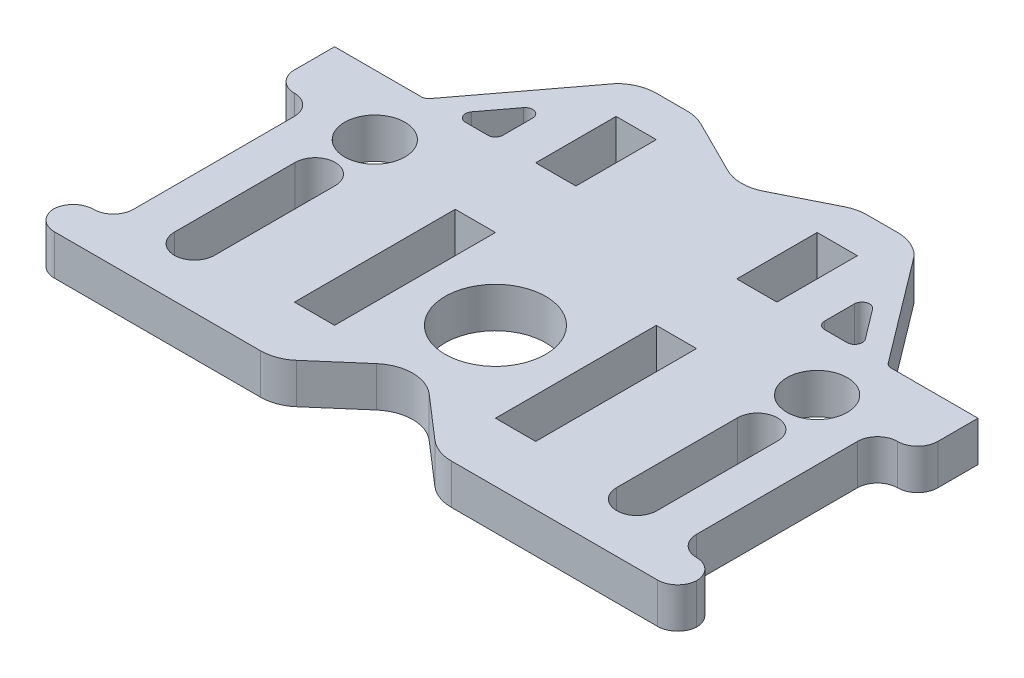
from build123d import *

# Parameters (mm, degrees)
SKETCH1_R           = 3.175
SKETCH1_W           = 3.175
SKETCH1_H           = 12.7
SKETCH1_H_2         = 6.35
BOSS_EXTRUDE1_DEPTH = 3.175
FILLET1_R           = 1.5875
SKETCH2_R           = 2.38125
CUT_EXTRUDE1_DEPTH  = 46.900442536
FILLET2_R           = 3.175
FILLET4_R           = 0.6
SKETCH3_W           = 59.294957885
SKETCH3_H           = 30.48
CUT_EXTRUDE5_DEPTH  = 46.900442536
FILLET5_R           = 1.5875
CUT_EXTRUDE6_DEPTH  = 34.89972345
SKETCH5_R           = 3.96875
CUT_EXTRUDE7_DEPTH  = 34.89972345
FILLET6_R           = 3.175


with BuildPart() as part:
    # Sketch1 → Boss-Extrude1 (new body)
    with BuildSketch(Plane(origin=(0, 0, 0), x_dir=(1, 0, 0), z_dir=(0, 1, 0))):
        with BuildLine():
            Line((25.4, -12.7), (25.4, -9.525))
            ThreePointArc((25.4, -9.525), (24.935032015, -8.402467985), (23.8125, -7.9375))
            ThreePointArc((23.8125, -7.9375), (22.689967985, -7.472532015), (22.225, -6.35))
            Line((22.225, -6.35), (22.225, 6.35))
            ThreePointArc((22.225, 6.35), (22.689967985, 7.472532015), (23.8125, 7.9375))
            ThreePointArc((23.8125, 7.9375), (24.935032015, 8.402467985), (25.4, 9.525))
            Line((25.4, 9.525), (25.4, 12.7))
            Line((25.4, 12.7), (23.8125, 12.7))
            Line((23.8125, 12.7), (18.25625, 12.7))
            Line((18.25625, 12.7), (11.77006403, 21.29506403))
            ThreePointArc((11.77006403, 21.29506403), (10.740019898, 21.983317516), (9.525, 22.225))
            Line((9.525, 22.225), (6.35, 22.225))
            Line((6.35, 22.225), (0, 19.05))
            Line((0, 19.05), (-6.35, 22.225))
            Line((-6.35, 22.225), (-9.525, 22.225))
            ThreePointArc((-9.525, 22.225), (-10.740019898, 21.983317516), (-11.77006403, 21.29506403))
            Line((-11.77006403, 21.29506403), (-18.25625, 12.7))
            Line((-18.25625, 12.7), (-23.8125, 12.7))
            Line((-23.8125, 12.7), (-25.4, 12.7))
            Line((-25.4, 12.7), (-25.4, 9.525))
            ThreePointArc((-25.4, 9.525), (-24.935032015, 8.402467985), (-23.8125, 7.9375))
            ThreePointArc((-23.8125, 7.9375), (-22.689967985, 7.472532015), (-22.225, 6.35))
            Line((-22.225, 6.35), (-22.225, -6.35))
            ThreePointArc((-22.225, -6.35), (-22.689967985, -7.472532015), (-23.8125, -7.9375))
            ThreePointArc((-23.8125, -7.9375), (-24.935032015, -8.402467985), (-25.4, -9.525))
            Line((-25.4, -9.525), (-25.4, -12.7))
            Line((-25.4, -12.7), (-25.4, -31.75))
            ThreePointArc((-25.4, -31.75), (-20.422679281, -37.949858998), (-13.293464066, -34.430446612))
            Line((-13.293464066, -34.430446612), (-3.175, -12.7))
            Line((-3.175, -12.7), (3.175, -12.7))
            Line((3.175, -12.7), (13.293464066, -34.430446612))
            ThreePointArc((13.293464066, -34.430446612), (20.422679281, -37.949858998), (25.4, -31.75))
            Line((25.4, -31.75), (25.4, -12.7))
        make_face()
        with Locations(Location((-19.05, -31.75, 0), (0, 0, 270))):
            Circle(SKETCH1_R, mode=Mode.SUBTRACT)
        with Locations(Location((19.05, -31.75, 0), (0, 0, 270))):
            Circle(SKETCH1_R, mode=Mode.SUBTRACT)
        with Locations((-7.9375, 0)):
            Rectangle(SKETCH1_W, SKETCH1_H, mode=Mode.SUBTRACT)
        with BuildLine():
            Line((-19.05, -12.7), (-19.05, -22.225))
            ThreePointArc((-19.05, -22.225), (-16.990981078, -22.450211503), (-15.029330082, -23.115196099))
            Line((-15.029330082, -23.115196099), (-10.179646624, -12.7))
            Line((-10.179646624, -12.7), (-19.05, -12.7))
        make_face(mode=Mode.SUBTRACT)
        with BuildLine():
            Line((10.179646624, -12.7), (19.05, -12.7))
            Line((19.05, -12.7), (19.05, -22.225))
            ThreePointArc((19.05, -22.225), (16.990981078, -22.450211503), (15.029330082, -23.115196099))
            Line((15.029330082, -23.115196099), (10.179646624, -12.7))
        make_face(mode=Mode.SUBTRACT)
        with Locations((7.9375, 0)):
            Rectangle(SKETCH1_W, SKETCH1_H, mode=Mode.SUBTRACT)
        with Locations((-7.9375, 15.875)):
            Rectangle(SKETCH1_W, SKETCH1_H_2, mode=Mode.SUBTRACT)
        Polygon((16.267445908, 12.7), (12.7, 12.7), (12.7, 17.427343025), align=None, mode=Mode.SUBTRACT)
        with Locations((7.9375, 15.875)):
            Rectangle(SKETCH1_W, SKETCH1_H_2, mode=Mode.SUBTRACT)
        Polygon((-12.7, 12.7), (-12.7, 17.427343025), (-16.267445908, 12.7), align=None, mode=Mode.SUBTRACT)
    extrude(amount=BOSS_EXTRUDE1_DEPTH)

    # Fillet1
    fillet1_edges = [part.edges().sort_by_distance(p)[0] for p in [
        (3.175, 1.5875, 12.7),
        (-3.175, 1.5875, 12.7),
        (-10.179646624, 1.5875, 12.7),
        (-19.05, 1.5875, 12.7),
        (19.05, 1.5875, 12.7),
        (10.179646624, 1.5875, 12.7),
    ]]
    fillet(fillet1_edges, radius=FILLET1_R)

    # Sketch2 → Cut-Extrude1 (cut, through all)
    with BuildSketch(Plane(origin=(0, 3.175, 0), x_dir=(1, 0, 0), z_dir=(0, 1, 0))):
        with Locations(Location((-17.4625, 7.9375, 0), (0, 0, 270))):
            Circle(SKETCH2_R)
        with Locations(Location((17.4625, 7.9375, 0), (0, 0, 90))):
            Circle(SKETCH2_R)
    extrude(amount=-CUT_EXTRUDE1_DEPTH, mode=Mode.SUBTRACT)

    # Fillet2
    fillet2_edges = [part.edges().sort_by_distance(p)[0] for p in [
        (-6.35, 1.5875, -22.225),
        (0, 1.5875, -19.05),
        (6.35, 1.5875, -22.225),
    ]]
    fillet(fillet2_edges, radius=FILLET2_R)

    # Fillet4
    fillet4_edges = [part.edges().sort_by_distance(p)[0] for p in [
        (18.25625, 1.5875, -12.7),
        (-18.25625, 1.5875, -12.7),
        (16.267445908, 1.5875, -12.7),
        (12.7, 1.5875, -17.427343025),
        (12.7, 1.5875, -12.7),
        (-12.7, 1.5875, -12.7),
        (-12.7, 1.5875, -17.427343025),
        (-16.267445908, 1.5875, -12.7),
    ]]
    fillet(fillet4_edges, radius=FILLET4_R)

    # Sketch3 → Cut-Extrude5 (cut, through all)
    with BuildSketch(Plane(origin=(0, 3.175, 0), x_dir=(1, 0, 0), z_dir=(0, 1, 0))):
        with Locations((-1.965596619, -26.253733592)):
            Rectangle(SKETCH3_W, SKETCH3_H)
    extrude(amount=-CUT_EXTRUDE5_DEPTH, mode=Mode.SUBTRACT)

    # Fillet5
    # the kernel refuses this fillet: 1.5875 mm, written as the material it takes off along each edge
    with BuildSketch(Plane(origin=(25.4, -3.961061605, 11.013733592), x_dir=(0, 0, -1), z_dir=(0, 1, 0))) as fillet5_piece_1:
        with BuildLine():
            CenterArc((1.5875, 1.584424642), FILLET5_R, 180, 86.433035976)
            Line((0, 1.584424642), (-0.03175, 1.584424642))
            Line((-0.03175, 1.584424642), (-0.03175, 0))
            Line((-0.03175, 0), (0, -0.03175))
            ThreePointArc((0, -0.03175), (0.744366796, -0.03175), (1.486758264, -0.031688493))
            Line((1.486758264, -0.031688493), (1.488733592, 0))
        make_face()
    extrude(amount=11.097123211, mode=Mode.SUBTRACT)
    with BuildSketch(Plane(origin=(-25.4, 7.136061605, 11.013733592), x_dir=(1, 0, 0), z_dir=(0, -1, 0))) as fillet5_piece_2:
        with BuildLine():
            CenterArc((1.584424642, -1.5875), FILLET5_R, 90, 86.433035976)
            Line((0, -1.488733592), (-0.031688493, -1.486758264))
            ThreePointArc((-0.031688493, -1.486758264), (-0.03175, -0.744366796), (-0.03175, 0))
            Line((-0.03175, 0), (0, 0.03175))
            Line((0, 0.03175), (1.584424642, 0.03175))
            Line((1.584424642, 0.03175), (1.584424642, 0))
        make_face()
    extrude(amount=11.097123211, mode=Mode.SUBTRACT)

    # Sketch4 → Cut-Extrude6 (cut, through all)
    with BuildSketch(Plane(origin=(0, 3.175, 0), x_dir=(1, 0, 0), z_dir=(0, 1, 0))):
        with BuildLine():
            Line((-15.875, 3.224383204), (-15.875, -6.300616796))
            ThreePointArc((-15.875, -6.300616796), (-17.4625, -7.888116796), (-19.05, -6.300616796))
            Line((-19.05, -6.300616796), (-19.05, 3.224383204))
            ThreePointArc((-19.05, 3.224383204), (-17.4625, 4.811883204), (-15.875, 3.224383204))
        make_face()
        with BuildLine():
            Line((15.875, 3.224383204), (15.875, -6.300616796))
            ThreePointArc((15.875, -6.300616796), (17.4625, -7.888116796), (19.05, -6.300616796))
            Line((19.05, -6.300616796), (19.05, 3.224383204))
            ThreePointArc((19.05, 3.224383204), (17.4625, 4.811883204), (15.875, 3.224383204))
        make_face()
    extrude(amount=-CUT_EXTRUDE6_DEPTH, mode=Mode.SUBTRACT)

    # Sketch5 → Cut-Extrude7 (cut, through all)
    with BuildSketch(Plane(origin=(0, 3.175, 0), x_dir=(1, 0, 0), z_dir=(0, 1, 0))):
        with Locations(Location((0, 0, 0), (0, 0, 270))):
            Circle(SKETCH5_R)
        Polygon((0, -5.506866796), (-6.35, -11.013733592), (6.35, -11.013733592), align=None)
    extrude(amount=-CUT_EXTRUDE7_DEPTH, mode=Mode.SUBTRACT)

    # Fillet6
    fillet6_edges = [part.edges().sort_by_distance(p)[0] for p in [
        (0, 1.5875, 5.506866796),
        (6.35, 1.5875, 11.013733592),
        (-6.35, 1.5875, 11.013733592),
    ]]
    fillet(fillet6_edges, radius=FILLET6_R)


solid = part.part
